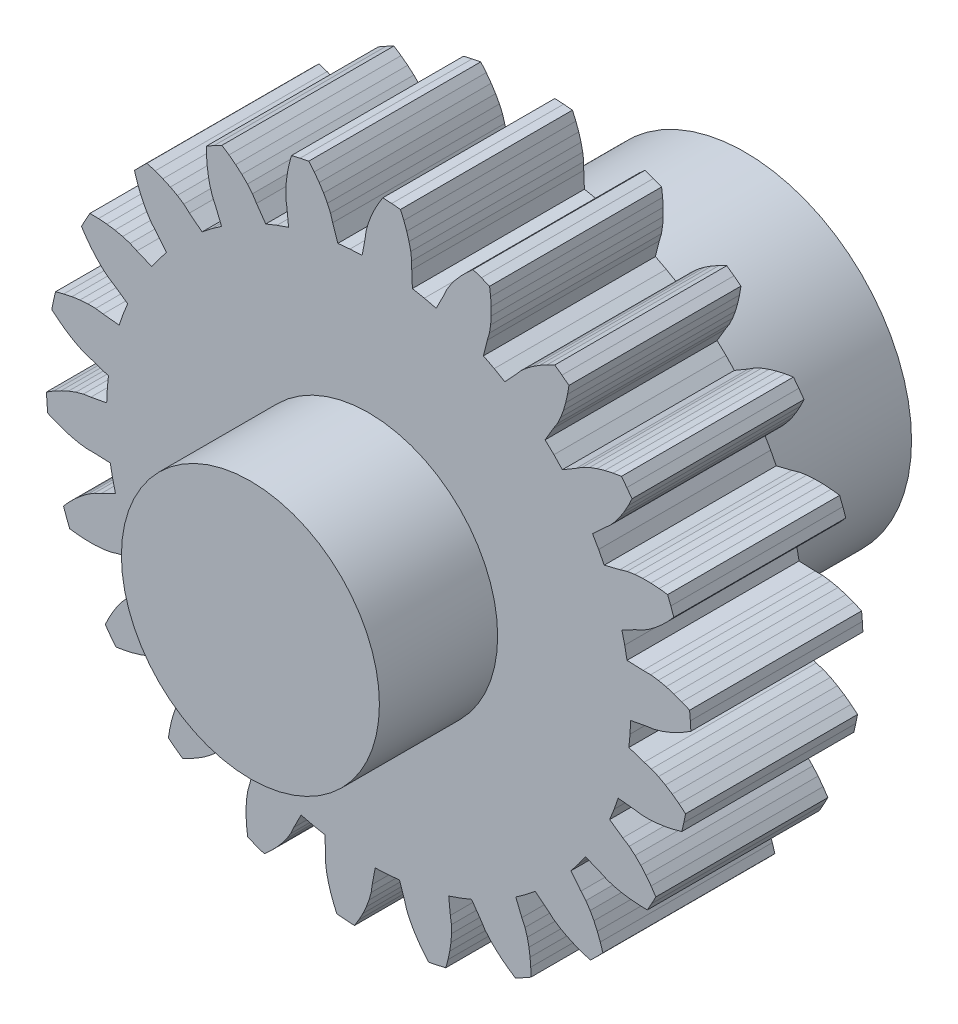
from build123d import *

# Parameters (mm, degrees)
F_22_START                                     = 42
F_22_TOOTH_MODULE_2_5_REFERENCE_INVOLUTE_DEPTH = 16
UPPER_START                                    = 58
SKETCH2_R                                      = 12
UPPER_BEARING_JOURNAL_DEPTH                    = 11
LOWER_START                                    = 42
SKETCH3_R                                      = 15.5
LOWER_BEARING_JOURNAL_DEPTH                    = 19
DRIVE_START                                    = 23
DRIVE_SOCKET_FROM_UNDERSIDE_DEPTH              = 10


with BuildPart() as part:
    # Sketch1 → 22 tooth module 2.5 reference involute (new body)
    with BuildSketch(Plane.XY.offset(F_22_START)):
        Polygon((24.367441358, -0.606981608), (25.839395494, -0.333459988), (26.533592259, -0.233829463), (27.227668857, -0.03986981), (27.919907828, 0.21986743), (28.60882814, 0.536011601), (29.292994671, 0.903486319), (29.970988022, 1.319043967), (29.923563438, 2.140175496), (29.853646107, 2.959698312), (29.123413732, 3.274537668), (28.393913924, 3.540904974), (27.667013822, 3.75578767), (26.944856381, 3.914365283), (26.230241146, 4.007573308), (25.528931401, 4.007395237), (24.03303345, 4.068651886), (23.817954858, 5.181278933), (23.551395248, 6.28270697), (24.886664954, 6.959846444), (25.52467271, 7.251019062), (26.13598958, 7.632665961), (26.727011572, 8.076908274), (27.298957665, 8.574337665), (27.851881052, 9.119679062), (28.38533479, 9.709416505), (28.10849175, 10.483925388), (27.810520304, 11.250553783), (27.021166974, 11.346909699), (26.246172692, 11.396963412), (25.4881777, 11.398350424), (24.750596233, 11.347049267), (24.038668201, 11.235151335), (23.365816597, 11.037398689), (21.913255032, 10.674730859), (21.393425371, 11.681694051), (20.827355161, 12.663407993), (21.917764826, 13.689307509), (22.447895979, 14.148433147), (22.926927863, 14.686848529), (23.36885179, 15.279606044), (23.777487993, 15.918021885), (24.154373672, 16.597049643), (24.500070547, 17.313189861), (24.016237228, 17.978329995), (23.514351541, 18.629956296), (22.729825969, 18.500022589), (21.97212264, 18.329707654), (21.244441004, 18.117486615), (20.551189976, 17.860462803), (19.899625322, 17.552524218), (19.309742294, 17.173217742), (18.018195013, 16.416006624), (17.235727791, 17.235727791), (16.416006624, 18.018195013), (17.173217742, 19.309742294), (17.552524218, 19.899625322), (17.860462803, 20.551189976), (18.117486615, 21.244441004), (18.329707654, 21.97212264), (18.500022589, 22.729825969), (18.629956296, 23.514351541), (17.978329995, 24.016237228), (17.313189861, 24.500070547), (16.597049643, 24.154373672), (15.918021885, 23.777487993), (15.279606044, 23.36885179), (14.686848529, 22.926927863), (14.148433147, 22.447895979), (13.689307509, 21.917764826), (12.663407993, 20.827355161), (11.681694051, 21.393425371), (10.674730859, 21.913255032), (11.037398689, 23.365816597), (11.235151335, 24.038668201), (11.347049267, 24.750596233), (11.398350424, 25.4881777), (11.396963412, 26.246172692), (11.346909699, 27.021166974), (11.250553783, 27.810520304), (10.483925388, 28.10849175), (9.709416505, 28.38533479), (9.119679062, 27.851881052), (8.574337665, 27.298957665), (8.076908274, 26.727011572), (7.632665961, 26.13598958), (7.251019062, 25.52467271), (6.959846444, 24.886664954), (6.28270697, 23.551395248), (5.181278933, 23.817954858), (4.068651886, 24.03303345), (4.007395237, 25.528931401), (4.007573308, 26.230241146), (3.914365283, 26.944856381), (3.75578767, 27.667013822), (3.540904974, 28.393913924), (3.274537668, 29.123413732), (2.959698312, 29.853646107), (2.140175496, 29.923563438), (1.319043967, 29.970988022), (0.903486319, 29.292994671), (0.536011601, 28.60882814), (0.21986743, 27.919907828), (-0.03986981, 27.227668857), (-0.233829463, 26.533592259), (-0.333459988, 25.839395494), (-0.606981608, 24.367441358), (-1.73889259, 24.312895294), (-2.867045066, 24.205798429), (-3.347263545, 25.623844009), (-3.544674474, 26.29679595), (-3.835437297, 26.956204513), (-4.191046664, 27.604433026), (-4.602016525, 28.241349115), (-5.063117931, 28.866254713), (-5.570934315, 29.47820705), (-6.376958687, 29.314405979), (-7.178189668, 29.128570049), (-7.385901511, 28.360964074), (-7.545738935, 27.600981502), (-7.654985765, 26.850899199), (-7.709175567, 26.113524332), (-7.699734517, 25.392917965), (-7.599751475, 24.698771884), (-7.447496145, 23.209382288), (-8.518189378, 22.838149547), (-9.570471078, 22.417553576), (-10.430746941, 23.642865167), (-10.809753812, 24.23294074), (-11.274515557, 24.783721269), (-11.798347323, 25.305505237), (-12.372110016, 25.800838159), (-12.990589826, 26.270523412), (-13.650242975, 26.71461897), (-14.377469602, 26.330369687), (-15.093889067, 25.926328565), (-15.076927527, 25.131296837), (-15.016178579, 24.357067493), (-14.909677539, 23.606590404), (-14.753929767, 22.88381737), (-14.541852871, 22.195060474), (-14.250356295, 21.557200665), (-13.684658837, 20.171037096), (-14.607393121, 19.513192748), (-15.49855444, 18.813171855), (-16.669193254, 19.746481999), (-17.199091183, 20.20587679), (-17.800199619, 20.603408322), (-18.449816049, 20.956475911), (-19.139888732, 21.270096739), (-19.865641391, 21.54651054), (-20.62369013, 21.78677134), (-21.213203436, 21.213203436), (-21.78677134, 20.62369013), (-21.54651054, 19.865641391), (-21.270096739, 19.139888732), (-20.956475911, 18.449816049), (-20.603408322, 17.800199619), (-20.20587679, 17.199091183), (-19.746481999, 16.669193254), (-18.813171855, 15.49855444), (-19.513192748, 14.607393121), (-20.171037096, 13.684658837), (-21.557200665, 14.250356295), (-22.195060474, 14.541852871), (-22.88381737, 14.753929767), (-23.606590404, 14.909677539), (-24.357067493, 15.016178579), (-25.131296837, 15.076927527), (-25.926328565, 15.093889067), (-26.330369687, 14.377469602), (-26.71461897, 13.650242975), (-26.270523412, 12.990589826), (-25.800838159, 12.372110016), (-25.305505237, 11.798347323), (-24.783721269, 11.274515557), (-24.23294074, 10.809753812), (-23.642865167, 10.430746941), (-22.417553576, 9.570471078), (-22.838149547, 8.518189378), (-23.209382288, 7.447496145), (-24.698771884, 7.599751475), (-25.392917965, 7.699734517), (-26.113524332, 7.709175567), (-26.850899199, 7.654985765), (-27.600981502, 7.545738935), (-28.360964074, 7.385901511), (-29.128570049, 7.178189668), (-29.314405979, 6.376958687), (-29.47820705, 5.570934315), (-28.866254713, 5.063117931), (-28.241349115, 4.602016525), (-27.604433026, 4.191046664), (-26.956204513, 3.835437297), (-26.29679595, 3.544674474), (-25.623844009, 3.347263545), (-24.205798429, 2.867045066), (-24.312895294, 1.73889259), (-24.367441358, 0.606981608), (-25.839395494, 0.333459988), (-26.533592259, 0.233829463), (-27.227668857, 0.03986981), (-27.919907828, -0.21986743), (-28.60882814, -0.536011601), (-29.292994671, -0.903486319), (-29.970988022, -1.319043967), (-29.923563438, -2.140175496), (-29.853646107, -2.959698312), (-29.123413732, -3.274537668), (-28.393913924, -3.540904974), (-27.667013822, -3.75578767), (-26.944856381, -3.914365283), (-26.230241146, -4.007573308), (-25.528931401, -4.007395237), (-24.03303345, -4.068651886), (-23.817954858, -5.181278933), (-23.551395248, -6.28270697), (-24.886664954, -6.959846444), (-25.52467271, -7.251019062), (-26.13598958, -7.632665961), (-26.727011572, -8.076908274), (-27.298957665, -8.574337665), (-27.851881052, -9.119679062), (-28.38533479, -9.709416505), (-28.10849175, -10.483925388), (-27.810520304, -11.250553783), (-27.021166974, -11.346909699), (-26.246172692, -11.396963412), (-25.4881777, -11.398350424), (-24.750596233, -11.347049267), (-24.038668201, -11.235151335), (-23.365816597, -11.037398689), (-21.913255032, -10.674730859), (-21.393425371, -11.681694051), (-20.827355161, -12.663407993), (-21.917764826, -13.689307509), (-22.447895979, -14.148433147), (-22.926927863, -14.686848529), (-23.36885179, -15.279606044), (-23.777487993, -15.918021885), (-24.154373672, -16.597049643), (-24.500070547, -17.313189861), (-24.016237228, -17.978329995), (-23.514351541, -18.629956296), (-22.729825969, -18.500022589), (-21.97212264, -18.329707654), (-21.244441004, -18.117486615), (-20.551189976, -17.860462803), (-19.899625322, -17.552524218), (-19.309742294, -17.173217742), (-18.018195013, -16.416006624), (-17.235727791, -17.235727791), (-16.416006624, -18.018195013), (-17.173217742, -19.309742294), (-17.552524218, -19.899625322), (-17.860462803, -20.551189976), (-18.117486615, -21.244441004), (-18.329707654, -21.97212264), (-18.500022589, -22.729825969), (-18.629956296, -23.514351541), (-17.978329995, -24.016237228), (-17.313189861, -24.500070547), (-16.597049643, -24.154373672), (-15.918021885, -23.777487993), (-15.279606044, -23.36885179), (-14.686848529, -22.926927863), (-14.148433147, -22.447895979), (-13.689307509, -21.917764826), (-12.663407993, -20.827355161), (-11.681694051, -21.393425371), (-10.674730859, -21.913255032), (-11.037398689, -23.365816597), (-11.235151335, -24.038668201), (-11.347049267, -24.750596233), (-11.398350424, -25.4881777), (-11.396963412, -26.246172692), (-11.346909699, -27.021166974), (-11.250553783, -27.810520304), (-10.483925388, -28.10849175), (-9.709416505, -28.38533479), (-9.119679062, -27.851881052), (-8.574337665, -27.298957665), (-8.076908274, -26.727011572), (-7.632665961, -26.13598958), (-7.251019062, -25.52467271), (-6.959846444, -24.886664954), (-6.28270697, -23.551395248), (-5.181278933, -23.817954858), (-4.068651886, -24.03303345), (-4.007395237, -25.528931401), (-4.007573308, -26.230241146), (-3.914365283, -26.944856381), (-3.75578767, -27.667013822), (-3.540904974, -28.393913924), (-3.274537668, -29.123413732), (-2.959698312, -29.853646107), (-2.140175496, -29.923563438), (-1.319043967, -29.970988022), (-0.903486319, -29.292994671), (-0.536011601, -28.60882814), (-0.21986743, -27.919907828), (0.03986981, -27.227668857), (0.233829463, -26.533592259), (0.333459988, -25.839395494), (0.606981608, -24.367441358), (1.73889259, -24.312895294), (2.867045066, -24.205798429), (3.347263545, -25.623844009), (3.544674474, -26.29679595), (3.835437297, -26.956204513), (4.191046664, -27.604433026), (4.602016525, -28.241349115), (5.063117931, -28.866254713), (5.570934315, -29.47820705), (6.376958687, -29.314405979), (7.178189668, -29.128570049), (7.385901511, -28.360964074), (7.545738935, -27.600981502), (7.654985765, -26.850899199), (7.709175567, -26.113524332), (7.699734517, -25.392917965), (7.599751475, -24.698771884), (7.447496145, -23.209382288), (8.518189378, -22.838149547), (9.570471078, -22.417553576), (10.430746941, -23.642865167), (10.809753812, -24.23294074), (11.274515557, -24.783721269), (11.798347323, -25.305505237), (12.372110016, -25.800838159), (12.990589826, -26.270523412), (13.650242975, -26.71461897), (14.377469602, -26.330369687), (15.093889067, -25.926328565), (15.076927527, -25.131296837), (15.016178579, -24.357067493), (14.909677539, -23.606590404), (14.753929767, -22.88381737), (14.541852871, -22.195060474), (14.250356295, -21.557200665), (13.684658837, -20.171037096), (14.607393121, -19.513192748), (15.49855444, -18.813171855), (16.669193254, -19.746481999), (17.199091183, -20.20587679), (17.800199619, -20.603408322), (18.449816049, -20.956475911), (19.139888732, -21.270096739), (19.865641391, -21.54651054), (20.62369013, -21.78677134), (21.213203436, -21.213203436), (21.78677134, -20.62369013), (21.54651054, -19.865641391), (21.270096739, -19.139888732), (20.956475911, -18.449816049), (20.603408322, -17.800199619), (20.20587679, -17.199091183), (19.746481999, -16.669193254), (18.813171855, -15.49855444), (19.513192748, -14.607393121), (20.171037096, -13.684658837), (21.557200665, -14.250356295), (22.195060474, -14.541852871), (22.88381737, -14.753929767), (23.606590404, -14.909677539), (24.357067493, -15.016178579), (25.131296837, -15.076927527), (25.926328565, -15.093889067), (26.330369687, -14.377469602), (26.71461897, -13.650242975), (26.270523412, -12.990589826), (25.800838159, -12.372110016), (25.305505237, -11.798347323), (24.783721269, -11.274515557), (24.23294074, -10.809753812), (23.642865167, -10.430746941), (22.417553576, -9.570471078), (22.838149547, -8.518189378), (23.209382288, -7.447496145), (24.698771884, -7.599751475), (25.392917965, -7.699734517), (26.113524332, -7.709175567), (26.850899199, -7.654985765), (27.600981502, -7.545738935), (28.360964074, -7.385901511), (29.128570049, -7.178189668), (29.314405979, -6.376958687), (29.47820705, -5.570934315), (28.866254713, -5.063117931), (28.241349115, -4.602016525), (27.604433026, -4.191046664), (26.956204513, -3.835437297), (26.29679595, -3.544674474), (25.623844009, -3.347263545), (24.205798429, -2.867045066), (24.312895294, -1.73889259), align=None)
    extrude(amount=F_22_TOOTH_MODULE_2_5_REFERENCE_INVOLUTE_DEPTH)

    # Sketch2 → Upper bearing journal (add)
    with BuildSketch(Plane.XY.offset(UPPER_START)):
        Circle(SKETCH2_R)
    extrude(amount=UPPER_BEARING_JOURNAL_DEPTH)

    # Sketch3 → Lower bearing journal (add)
    with BuildSketch(Plane.XY.offset(LOWER_START)):
        Circle(SKETCH3_R)
    extrude(amount=-LOWER_BEARING_JOURNAL_DEPTH)

    # Sketch4 → Drive socket from underside (cut)
    with BuildSketch(Plane.XY.offset(DRIVE_START)):
        Polygon((1.02, 12.556450199), (-1.02, 12.556450199), (-12.556450199, 1.02), (-12.556450199, -1.02), (-1.02, -12.556450199), (1.02, -12.556450199), (12.556450199, -1.02), (12.556450199, 1.02), align=None)
    extrude(amount=DRIVE_SOCKET_FROM_UNDERSIDE_DEPTH, mode=Mode.SUBTRACT)


solid = part.part
